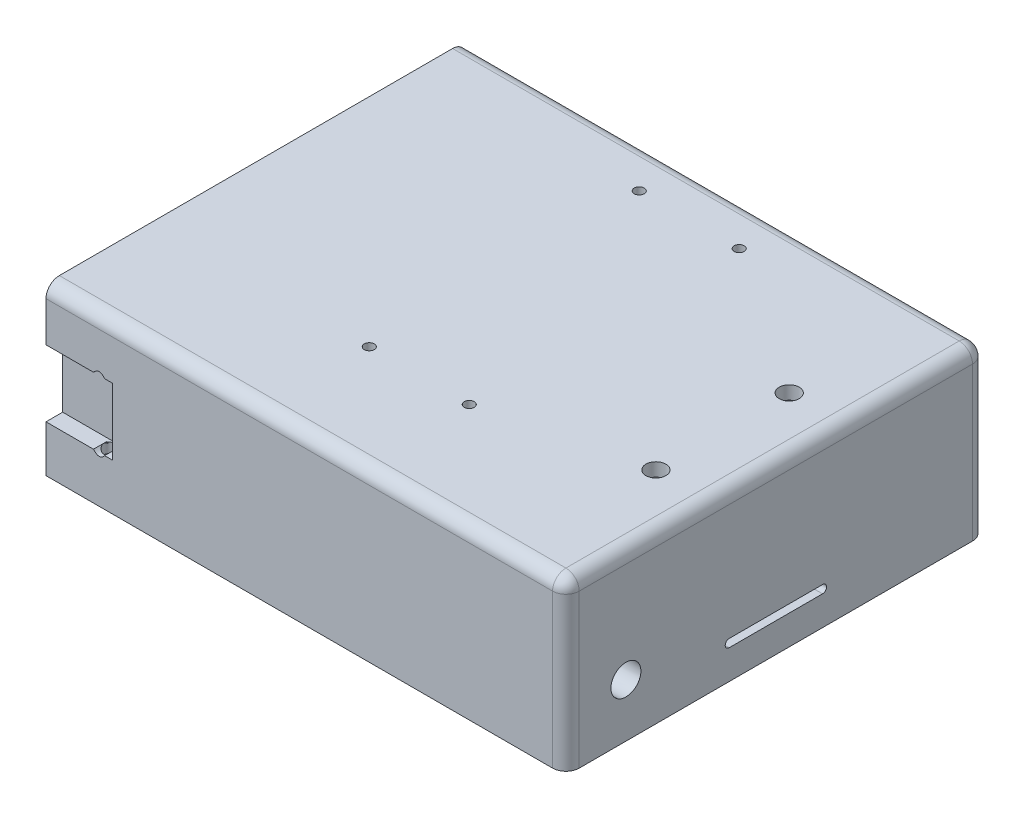
from build123d import *

# Parameters (mm, degrees)
SKETCH1_W               = 80
SKETCH1_H               = 63
BOSS_EXTRUDE2_DEPTH     = 25
SKETCH1_4_W             = 76
SKETCH1_4_H             = 55
CUT_EXTRUDE1_DEPTH      = 23
CUT_EXTRUDE2_DEPTH      = 20
SKETCH4_W               = 2
SKETCH4_H               = 55
BOSS_EXTRUDE3_DEPTH     = 10
FILLET1_R               = 2
SKETCH5_W               = 2
SKETCH5_H               = 63
CUT_EXTRUDE3_DEPTH      = 105.852277038
SKETCH6_W               = 2.2
SKETCH6_H               = 2.2
CUT_EXTRUDE4_DEPTH      = 76
SKETCH7_W               = 10
SKETCH7_H               = 10
CUT_EXTRUDE5_DEPTH      = 2.5
CUT_EXTRUDE6_DEPTH      = 11.5
CUT_EXTRUDE6_DEPTH_BACK = 1.5
SKETCH8_R               = 0.875
SKETCH9_W               = 10
SKETCH9_H               = 10
CUT_EXTRUDE7_DEPTH      = 2.5
CUT_EXTRUDE8_DEPTH      = 11.5
CUT_EXTRUDE8_DEPTH_BACK = 1.5
SKETCH10_R              = 0.875
CUT_EXTRUDE9_DEPTH      = 2
CUT_EXTRUDE10_DEPTH     = 2
SKETCH13_R              = 0.75
CUT_EXTRUDE11_DEPTH     = 105.393486469
FILLET2_R               = 0.3
CUT_EXTRUDE13_REACH     = 86.524
SKETCH15_W              = 5
SKETCH15_H              = 10
FILLET3_R               = 1
SKETCH16_R              = 4.25
BOSS_EXTRUDE4_DEPTH     = 5
CUT_EXTRUDE14_DEPTH     = 10
SKETCH21_R              = 1.5
CUT_EXTRUDE15_DEPTH     = 10


with BuildPart() as part:
    # Sketch1 → Boss-Extrude2 (new body)
    with BuildSketch(Plane(origin=(0, 0, 0), x_dir=(1, 0, 0), z_dir=(0, 1, 0))):
        with Locations((40, 31.5)):
            Rectangle(SKETCH1_W, SKETCH1_H)
    extrude(amount=BOSS_EXTRUDE2_DEPTH)

    # Sketch1<4> → Cut-Extrude1 (cut)
    with BuildSketch(Plane(origin=(0, 0, 0), x_dir=(1, 0, 0), z_dir=(0, 1, 0))):
        with Locations((40, 31.5)):
            Rectangle(SKETCH1_4_W, SKETCH1_4_H)
    extrude(amount=CUT_EXTRUDE1_DEPTH, mode=Mode.SUBTRACT)

    # Sketch3 → Cut-Extrude2 (cut)
    with BuildSketch(Plane(origin=(80, 0, 0), x_dir=(0, 0, -1), z_dir=(1, 0, 0))):
        with BuildLine():
            Line((38.5, 4.4), (24.5, 4.4))
            ThreePointArc((24.5, 4.4), (23.9, 5), (24.5, 5.6))
            Line((24.5, 5.6), (38.5, 5.6))
            ThreePointArc((38.5, 5.6), (39.1, 5), (38.5, 4.4))
        make_face()
    extrude(amount=-CUT_EXTRUDE2_DEPTH, mode=Mode.SUBTRACT)

    # Sketch4 → Boss-Extrude3 (add)
    with BuildSketch(Plane.XZ.offset(-23)):
        with Locations((30.5, -31.5)):
            Rectangle(SKETCH4_W, SKETCH4_H)
    extrude(amount=BOSS_EXTRUDE3_DEPTH)

    # Fillet1
    fillet1_edges = [part.edges().sort_by_distance(p)[0] for p in [
        (80, 25, -31.5),
        (40, 25, 0),
        (0, 25, -31.5),
        (0, 12.5, 0),
        (80, 12.5, 0),
        (80, 12.5, -63),
        (0, 12.5, -63),
        (40, 25, -63),
    ]]
    fillet(fillet1_edges, radius=FILLET1_R)

    # Sketch5 → Cut-Extrude3 (cut, through all)
    with BuildSketch(Plane(origin=(0, 0, 0), x_dir=(-1, 0, 0), z_dir=(0, -1, 0))):
        with Locations((-1, 31.5)):
            Rectangle(SKETCH5_W, SKETCH5_H)
    extrude(amount=-CUT_EXTRUDE3_DEPTH, mode=Mode.SUBTRACT)

    # Sketch6 → Cut-Extrude4 (cut)
    with BuildSketch(Plane.ZY.offset(-2)):
        with Locations((-2.9, 1.85)):
            Rectangle(SKETCH6_W, SKETCH6_H)
        with Locations((-60.1, 1.85)):
            Rectangle(SKETCH6_W, SKETCH6_H)
    extrude(amount=-CUT_EXTRUDE4_DEPTH, mode=Mode.SUBTRACT)

    # Sketch7 → Cut-Extrude5 (cut)
    with BuildSketch(Plane(origin=(0, 0, -63), x_dir=(-1, 0, 0), z_dir=(0, 0, -1))):
        with Locations((-7, 12)):
            Rectangle(SKETCH7_W, SKETCH7_H)
    extrude(amount=-CUT_EXTRUDE5_DEPTH, mode=Mode.SUBTRACT)

    # Sketch8 → Cut-Extrude6 (cut, two sides: drawn at the far end of the back side and taken through both)
    with BuildSketch(Plane(origin=(0, 7, 0), x_dir=(1, 0, 0), z_dir=(0, 1, 0)).offset(-CUT_EXTRUDE6_DEPTH_BACK)):
        with Locations(Location((10, 61.5, 0), (0, 0, 270))):
            Circle(SKETCH8_R)
    extrude(amount=CUT_EXTRUDE6_DEPTH + CUT_EXTRUDE6_DEPTH_BACK, mode=Mode.SUBTRACT)

    # Sketch9 → Cut-Extrude7 (cut)
    with BuildSketch(Plane.XY):
        with Locations((7, 12)):
            Rectangle(SKETCH9_W, SKETCH9_H)
    extrude(amount=-CUT_EXTRUDE7_DEPTH, mode=Mode.SUBTRACT)

    # Sketch10 → Cut-Extrude8 (cut, two sides: drawn at the far end of the back side and taken through both)
    with BuildSketch(Plane(origin=(0, 7, 0), x_dir=(1, 0, 0), z_dir=(0, 1, 0)).offset(-CUT_EXTRUDE8_DEPTH_BACK)):
        with Locations((10, 1.5)):
            Circle(SKETCH10_R)
    extrude(amount=CUT_EXTRUDE8_DEPTH + CUT_EXTRUDE8_DEPTH_BACK, mode=Mode.SUBTRACT)

    # Sketch11 → Cut-Extrude9 (cut)
    with BuildSketch(Plane(origin=(0, 0, -63), x_dir=(-1, 0, 0), z_dir=(0, 0, -1))):
        with BuildLine():
            Line((-9.122986176, 7), (-10.8, 7))
            add(Edge.make_bspline(
                [(-10.8, 7), (-10.004539285, 5.994886644), (-9.122986176, 7)],
                knots=[0, 0, 0, 1, 1, 1], degree=2))
        make_face()
        with BuildLine():
            Line((-9.122986176, 17), (-10.8, 17))
            add(Edge.make_bspline(
                [(-10.8, 17), (-10.004539285, 18.005113356), (-9.122986176, 17)],
                knots=[0, 0, 0, 1, 1, 1], degree=2))
        make_face()
    extrude(amount=-CUT_EXTRUDE9_DEPTH, mode=Mode.SUBTRACT)

    # Sketch12 → Cut-Extrude10 (cut)
    with BuildSketch(Plane.XY):
        with BuildLine():
            Line((10.8, 7), (9.120131213, 7))
            add(Edge.make_bspline(
                [(10.8, 7), (10.003016043, 5.994891859), (9.120131213, 7)],
                knots=[0, 0, 0, 1, 1, 1], degree=2))
        make_face()
        with BuildLine():
            Line((10.8, 17), (9.120131213, 17))
            add(Edge.make_bspline(
                [(10.8, 17), (10.003016043, 18.005108141), (9.120131213, 17)],
                knots=[0, 0, 0, 1, 1, 1], degree=2))
        make_face()
    extrude(amount=-CUT_EXTRUDE10_DEPTH, mode=Mode.SUBTRACT)

    # Sketch13 → Cut-Extrude11 (cut, through all)
    with BuildSketch(Plane(origin=(0, 23, 0), x_dir=(-1, 0, 0), z_dir=(0, -1, 0))):
        with Locations(Location((-34.5, 56.5, 0), (0, 0, 90))):
            Circle(SKETCH13_R)
        with Locations(Location((-49.5, 56.5, 0), (0, 0, 90))):
            Circle(SKETCH13_R)
        with Locations(Location((-34.5, 16, 0), (0, 0, 90))):
            Circle(SKETCH13_R)
        with Locations(Location((-49.5, 16, 0), (0, 0, 90))):
            Circle(SKETCH13_R)
    extrude(amount=-CUT_EXTRUDE11_DEPTH, mode=Mode.SUBTRACT)

    # Fillet2
    fillet2_edges = [part.edges().sort_by_distance(p)[0] for p in [
        (40, 2.95, -59),
        (2, 0.75, -60.1),
        (2, 1.85, -61.2),
        (40, 0.75, -61.2),
        (40, 2.95, -61.2),
        (2, 2.95, -60.1),
        (2, 2.95, -2.9),
        (40, 2.95, -4),
        (40, 2.95, -1.8),
        (40, 0.75, -1.8),
        (2, 0.75, -2.9),
        (2, 1.85, -1.8),
    ]]
    fillet(fillet2_edges, radius=FILLET2_R)

    # Sketch15 → Cut-Extrude13 (cut, up to next)
    with BuildSketch(Plane.ZY.offset(-29.5), mode=Mode.PRIVATE) as cut_extrude13_sk1:
        with Locations((-6.5, 18)):
            Rectangle(SKETCH15_W, SKETCH15_H)
    cut_extrude13_tool1 = extrude(cut_extrude13_sk1.sketch, amount=-CUT_EXTRUDE13_REACH, mode=Mode.PRIVATE) & part.part
    add(cut_extrude13_tool1.solids().sort_by_distance((29.5, 18, -6.5))[0], mode=Mode.SUBTRACT)

    # Fillet3
    fillet3_edges = [part.edges().sort_by_distance(p)[0] for p in [
        (29.5, 13, -34),
        (30.5, 13, -9),
        (29.5, 18, -59),
        (31.5, 18, -59),
        (30.5, 13, -59),
        (31.5, 13, -34),
    ]]
    fillet(fillet3_edges, radius=FILLET3_R - 0.0001)  # a hair under: the kernel refuses the full size

    # Sketch16 → Boss-Extrude4 (add)
    with BuildSketch(Plane.ZY.offset(-78)):
        with Locations((-9, 8)):
            Circle(SKETCH16_R)
    extrude(amount=BOSS_EXTRUDE4_DEPTH)

    # Cut-Loft1: read off the stored shape, not the designer's step
    # Cut-Loft1: loft between two sections, ruled curve by curve
    cut_loft1_from = [
        Edge.make_bspline([(73, 5.618142213, -10.374501175), (73, 8.367144563, -15.13821675), (73, 13.130860138, -12.3892144), (73, 10.381857787, -7.625498825), (73, 7.632855437, -2.86178325), (73, 2.869139862, -5.6107856), (73, 5.618142213, -10.374501175)], [0, 0, 0, 0, 0.5, 0.5, 0.5, 1, 1, 1, 1], 3, [1, 0.333333333, 0.333333333, 1, 0.333333333, 0.333333333, 1]),
    ]
    cut_loft1_to = [
        Edge.make_bspline([(80, 6.404019358, -10.585984171), (80, 9.575987701, -13.777945454), (80, 12.767948984, -10.605977112), (80, 9.595980642, -7.414015829), (80, 6.424012299, -4.222054546), (80, 3.232051016, -7.394022888), (80, 6.404019358, -10.585984171)], [0, 0, 0, 0, 0.5, 0.5, 0.5, 1, 1, 1, 1], 3, [1, 0.333333333, 0.333333333, 1, 0.333333333, 0.333333333, 1]),
    ]
    cut_loft1 = Solid(Shell([*[Face.make_surface_from_curves(cut_loft1_from[k], cut_loft1_to[k]) for k in range(1)], Face(Wire(cut_loft1_from)), Face(Wire(cut_loft1_to))]))
    add(cut_loft1, mode=Mode.SUBTRACT)

    # Sketch20 → Cut-Extrude14 (cut)
    with BuildSketch(Plane(origin=(0, 0, -63), x_dir=(-1, 0, 0), z_dir=(0, 0, -1))):
        with BuildLine():
            Line((-38.5, 15.2), (-45.5, 15.2))
            ThreePointArc((-45.5, 15.2), (-48.5, 18.2), (-45.5, 21.2))
            Line((-45.5, 21.2), (-38.5, 21.2))
            ThreePointArc((-38.5, 21.2), (-35.5, 18.2), (-38.5, 15.2))
        make_face()
    extrude(amount=-CUT_EXTRUDE14_DEPTH, mode=Mode.SUBTRACT)

    # Sketch21 → Cut-Extrude15 (cut)
    with BuildSketch(Plane.XZ.offset(-23)):
        with Locations(Location((72, -41.5, 0), (0, 0, 270))):
            Circle(SKETCH21_R)
        with Locations(Location((72, -21.5, 0), (0, 0, 270))):
            Circle(SKETCH21_R)
    extrude(amount=-CUT_EXTRUDE15_DEPTH, mode=Mode.SUBTRACT)


solid = part.part
